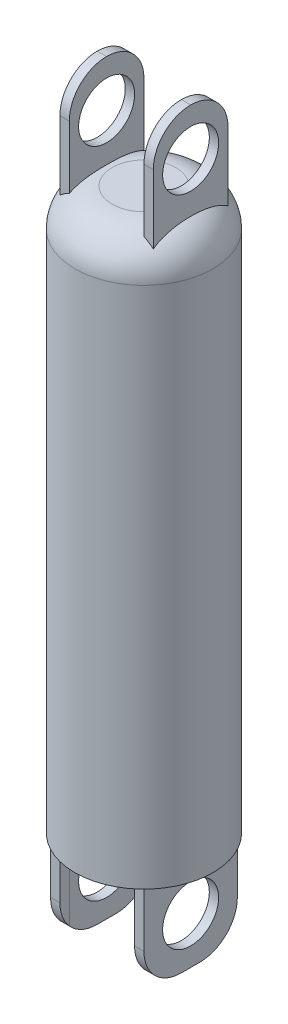
from build123d import *

# Parameters (mm, degrees)
SKETCH1_R           = 3.7
BOSS_EXTRUDE1_DEPTH = 30
SKETCH2_W           = 5
SKETCH2_H           = 4
SKETCH2_W_2         = 4
SKETCH2_H_2         = 3
BOSS_EXTRUDE2_DEPTH = 5
SKETCH3_W           = 4
SKETCH3_H           = 4.53219821
CUT_EXTRUDE1_DEPTH  = 5
SKETCH4_R           = 1.5
CUT_EXTRUDE2_DEPTH  = 15
FILLET1_R           = 2
FILLET2_R           = 2
SKETCH5_W           = 5
SKETCH5_H           = 5
SKETCH5_W_2         = 4
SKETCH5_H_2         = 4
BOSS_EXTRUDE3_DEPTH = 5
SKETCH6_W           = 3.994620944
SKETCH6_H           = 5.818695304
CUT_EXTRUDE3_DEPTH  = 5
SKETCH7_R           = 1.5
CUT_EXTRUDE4_DEPTH  = 5
FILLET3_R           = 2


# Some blends are built 0.0001 mm under size
with BuildPart() as part:
    # Sketch1 → Boss-Extrude1 (new body)
    with BuildSketch(Plane(origin=(0, 0, 0), x_dir=(1, 0, 0), z_dir=(0, 1, 0))):
        with Locations(Location((0, 0, 0), (0, 0, 270))):
            Circle(SKETCH1_R)
    extrude(amount=BOSS_EXTRUDE1_DEPTH)

    # Sketch2 → Boss-Extrude2 (add)
    with BuildSketch(Plane(origin=(0, 30, 0), x_dir=(1, 0, 0), z_dir=(0, 1, 0))):
        Rectangle(SKETCH2_W, SKETCH2_H)
        Rectangle(SKETCH2_W_2, SKETCH2_H_2, mode=Mode.SUBTRACT)
    extrude(amount=BOSS_EXTRUDE2_DEPTH)

    # Sketch3 → Cut-Extrude1 (cut)
    with BuildSketch(Plane(origin=(0, 35, 0), x_dir=(1, 0, 0), z_dir=(0, 1, 0))):
        Rectangle(SKETCH3_W, SKETCH3_H)
    extrude(amount=-CUT_EXTRUDE1_DEPTH, mode=Mode.SUBTRACT)

    # Sketch4 → Cut-Extrude2 (cut)
    with BuildSketch(Plane.ZY.offset(2.5)):
        with Locations((0, 32.5)):
            Circle(SKETCH4_R)
    extrude(amount=-CUT_EXTRUDE2_DEPTH, mode=Mode.SUBTRACT)

    # Fillet1
    fillet1_edges = [part.edges().sort_by_distance(p)[0] for p in [
        (-2.25, 35, 2),
        (-2.25, 35, -2),
        (2.25, 35, -2),
        (2.25, 35, 2),
    ]]
    fillet(fillet1_edges, radius=FILLET1_R - 0.0001)  # a hair under: the kernel refuses the full size

    # Fillet2
    # the kernel refuses this fillet: 2 mm, written as the material it takes off along each edge
    with BuildSketch(Plane(origin=(0, 30, 0), x_dir=(0, 0, 1), z_dir=(-1, 0, 0))) as fillet2_piece_1_section:
        with BuildLine():
            CenterArc((3.7 - FILLET2_R, -FILLET2_R), FILLET2_R, 0, 90)
            Line((3.7, -FILLET2_R), (3.7, 0))
            Line((3.7, 0), (3.7 - FILLET2_R, 0))
        make_face()
    fillet2_piece_1 = revolve(axis=Axis((0, 30, 0), (0, 1, 0)), mode=Mode.PRIVATE)
    fillet2_piece_1 = split(fillet2_piece_1, bisect_by=Plane(origin=(2, 29.996904363, 0.950092039), z_dir=(-1, 0, 0)), keep=Keep.TOP, mode=Mode.PRIVATE)
    fillet2_piece_1 = split(fillet2_piece_1, bisect_by=Plane(origin=(-2, 29.996904363, 0.950092039), z_dir=(1, 0, 0)), keep=Keep.TOP, mode=Mode.PRIVATE)
    add(fillet2_piece_1, mode=Mode.SUBTRACT)
    with BuildSketch(Plane(origin=(0, 30, 0), x_dir=(0, 0, 1), z_dir=(-1, 0, 0))) as fillet2_piece_2_section:
        with BuildLine():
            CenterArc((3.7 - FILLET2_R, -FILLET2_R), FILLET2_R, 0, 90)
            Line((3.7, -FILLET2_R), (3.7, 0))
            Line((3.7, 0), (3.7 - FILLET2_R, 0))
        make_face()
    fillet2_piece_2 = revolve(axis=Axis((0, 30, 0), (0, 1, 0)), mode=Mode.PRIVATE)
    fillet2_piece_2 = split(fillet2_piece_2, bisect_by=Plane(origin=(2.24397726, 29.466228533, 2), z_dir=(0, 0, 1)), keep=Keep.TOP, mode=Mode.PRIVATE)
    add(fillet2_piece_2, mode=Mode.SUBTRACT)
    with BuildSketch(Plane(origin=(0, 30, 0), x_dir=(0, 0, 1), z_dir=(-1, 0, 0))) as fillet2_piece_3_section:
        with BuildLine():
            CenterArc((3.7 - FILLET2_R, -FILLET2_R), FILLET2_R, 0, 90)
            Line((3.7, -FILLET2_R), (3.7, 0))
            Line((3.7, 0), (3.7 - FILLET2_R, 0))
        make_face()
    fillet2_piece_3 = revolve(axis=Axis((0, 30, 0), (0, 1, 0)), mode=Mode.PRIVATE)
    fillet2_piece_3 = split(fillet2_piece_3, bisect_by=Plane(origin=(2.5, 29.502863649, 1.19e-07), z_dir=(1, 0, 0)), keep=Keep.TOP, mode=Mode.PRIVATE)
    add(fillet2_piece_3, mode=Mode.SUBTRACT)
    with BuildSketch(Plane(origin=(0, 30, 0), x_dir=(0, 0, 1), z_dir=(-1, 0, 0))) as fillet2_piece_4_section:
        with BuildLine():
            CenterArc((3.7 - FILLET2_R, -FILLET2_R), FILLET2_R, 0, 90)
            Line((3.7, -FILLET2_R), (3.7, 0))
            Line((3.7, 0), (3.7 - FILLET2_R, 0))
        make_face()
    fillet2_piece_4 = revolve(axis=Axis((0, 30, 0), (0, 1, 0)), mode=Mode.PRIVATE)
    fillet2_piece_4 = split(fillet2_piece_4, bisect_by=Plane(origin=(2.243977257, 29.466228303, -2), z_dir=(0, 0, -1)), keep=Keep.TOP, mode=Mode.PRIVATE)
    add(fillet2_piece_4, mode=Mode.SUBTRACT)
    with BuildSketch(Plane(origin=(0, 30, 0), x_dir=(0, 0, 1), z_dir=(-1, 0, 0))) as fillet2_piece_5_section:
        with BuildLine():
            CenterArc((3.7 - FILLET2_R, -FILLET2_R), FILLET2_R, 0, 90)
            Line((3.7, -FILLET2_R), (3.7, 0))
            Line((3.7, 0), (3.7 - FILLET2_R, 0))
        make_face()
    fillet2_piece_5 = revolve(axis=Axis((0, 30, 0), (0, 1, 0)), mode=Mode.PRIVATE)
    fillet2_piece_5 = split(fillet2_piece_5, bisect_by=Plane(origin=(-2.5, 29.50286365, -1.18e-07), z_dir=(-1, 0, 0)), keep=Keep.TOP, mode=Mode.PRIVATE)
    add(fillet2_piece_5, mode=Mode.SUBTRACT)

    # Sketch5 → Boss-Extrude3 (add)
    with BuildSketch(Plane.XZ):
        Rectangle(SKETCH5_W, SKETCH5_H)
        Rectangle(SKETCH5_W_2, SKETCH5_H_2, mode=Mode.SUBTRACT)
    extrude(amount=BOSS_EXTRUDE3_DEPTH)

    # Sketch6 → Cut-Extrude3 (cut)
    with BuildSketch(Plane.XZ.offset(5)):
        Rectangle(SKETCH6_W, SKETCH6_H)
    extrude(amount=-CUT_EXTRUDE3_DEPTH, mode=Mode.SUBTRACT)

    # Sketch7 → Cut-Extrude4 (cut)
    with BuildSketch(Plane(origin=(2.5, 0, 0), x_dir=(0, 0, -1), z_dir=(1, 0, 0))):
        with Locations((0, -2.5)):
            Circle(SKETCH7_R)
    extrude(amount=-CUT_EXTRUDE4_DEPTH, mode=Mode.SUBTRACT)

    # Fillet3
    fillet3_edges = [part.edges().sort_by_distance(p)[0] for p in [
        (-2.248655236, -5, -2.5),
        (-2.248655236, -5, 2.5),
        (2.248655236, -5, 2.5),
        (2.248655236, -5, -2.5),
    ]]
    fillet(fillet3_edges, radius=FILLET3_R)


solid = part.part
